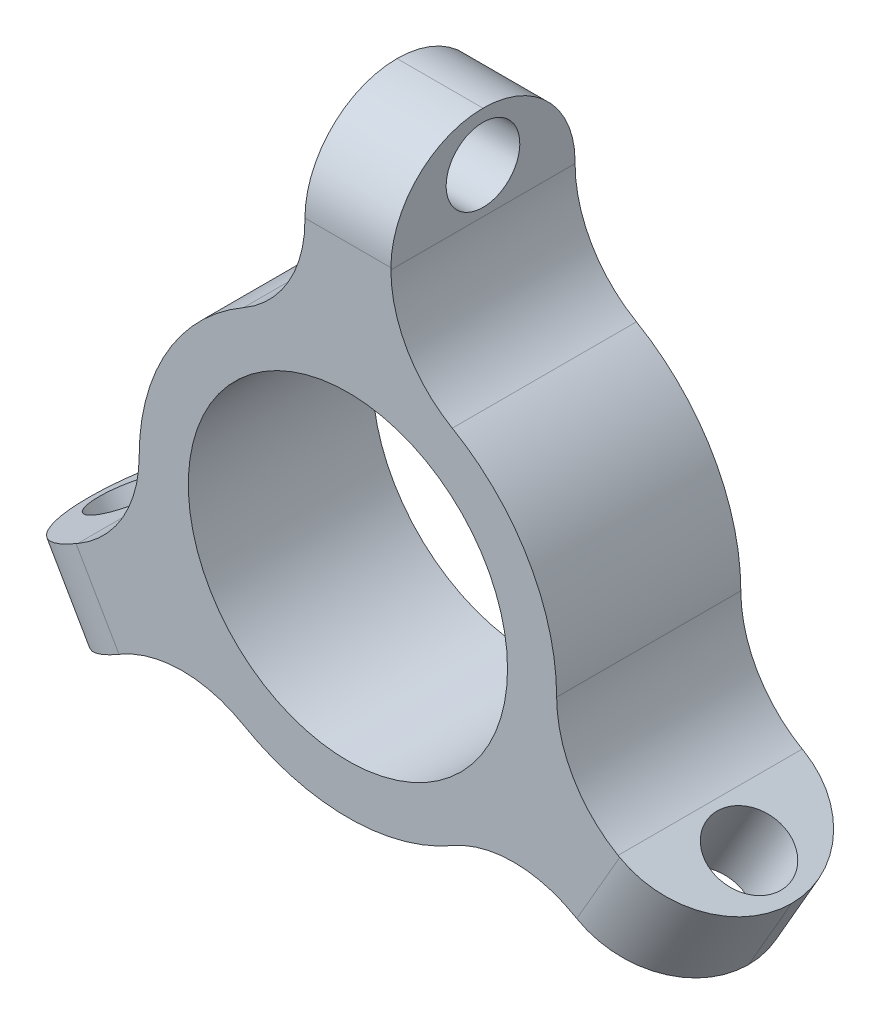
from build123d import *

# Parameters (mm, degrees)
ESQUISSE1_R                  = 13
BOSS_EXTRU_1_DEPTH           = 15
CONG_1_R                     = 7.5
CONG_2_R                     = 7.5
CONG_3_R                     = 7.5
ENL_V_MAT_EXTRU_1_REACH      = 50.052
ESQUISSE2_R                  = 3
R_P_TITION_CIRCULAIRE1_COUNT = 3


with BuildPart() as part:
    # Esquisse1 → Boss.-Extru.1 (new body)
    with BuildSketch(Plane.XY):
        with BuildLine():
            Line((-3.5, 23.382685902), (-3.5, 31.041209697))
            Line((-3.5, 31.041209697), (3.5, 31.041209697))
            Line((3.5, 31.041209697), (3.5, 23.382685902))
            ThreePointArc((3.5, 23.382685902), (4.839745962, 18.382685902), (8.5, 14.722431864))
            ThreePointArc((8.5, 14.722431864), (14.722431864, 8.5), (17, 0))
            ThreePointArc((17, 0), (18.339745962, -5), (22, -8.660254038))
            Line((22, -8.660254038), (28.632476161, -12.489515935))
            Line((28.632476161, -12.489515935), (25.132476161, -18.551693762))
            Line((25.132476161, -18.551693762), (18.5, -14.722431864))
            ThreePointArc((18.5, -14.722431864), (13.5, -13.382685902), (8.5, -14.722431864))
            ThreePointArc((8.5, -14.722431864), (0, -17), (-8.5, -14.722431864))
            ThreePointArc((-8.5, -14.722431864), (-13.5, -13.382685902), (-18.5, -14.722431864))
            Line((-18.5, -14.722431864), (-25.132476161, -18.551693762))
            Line((-25.132476161, -18.551693762), (-28.632476161, -12.489515935))
            Line((-28.632476161, -12.489515935), (-22, -8.660254038))
            ThreePointArc((-22, -8.660254038), (-18.339745962, -5), (-17, 0))
            ThreePointArc((-17, 0), (-14.722431864, 8.5), (-8.5, 14.722431864))
            ThreePointArc((-8.5, 14.722431864), (-4.839745962, 18.382685902), (-3.5, 23.382685902))
        make_face()
        Circle(ESQUISSE1_R, mode=Mode.SUBTRACT)
    extrude(amount=BOSS_EXTRU_1_DEPTH)

    # Congé1
    cong_1_edges = [part.edges().sort_by_distance(p)[0] for p in [
        (0, 31.041209697, 0),
        (0, 31.041209697, 15),
    ]]
    fillet(cong_1_edges, radius=CONG_1_R - 0.0001)  # a hair under: the kernel refuses the full size

    # Congé2
    cong_2_edges = [part.edges().sort_by_distance(p)[0] for p in [
        (26.882476161, -15.520604848, 0),
        (26.882476161, -15.520604848, 15),
    ]]
    fillet(cong_2_edges, radius=CONG_2_R - 0.0001)  # a hair under: the kernel refuses the full size

    # Congé3
    cong_3_edges = [part.edges().sort_by_distance(p)[0] for p in [
        (-26.882476161, -15.520604848, 15),
        (-26.882476161, -15.520604848, 0),
    ]]
    fillet(cong_3_edges, radius=CONG_3_R - 0.0001)  # a hair under: the kernel refuses the full size

    # Esquisse2 → Enlèv. mat.-Extru.1 (cut, up to next)
    with BuildSketch(Plane(origin=(-1.75, -3.031088913, 0), x_dir=(0.8660254037844389, -0.4999999999999995, 0), z_dir=(-0.4999999999999995, -0.8660254037844389, 0)), mode=Mode.PRIVATE) as enl_v_mat_extru_1_sk1:
        with Locations((27.041209697, 7.5)):
            Circle(ESQUISSE2_R)
    enl_v_mat_extru_1_tool1 = extrude(enl_v_mat_extru_1_sk1.sketch, amount=-ENL_V_MAT_EXTRU_1_REACH, mode=Mode.PRIVATE) & part.part
    enl_v_mat_extru_1 = enl_v_mat_extru_1_tool1.solids().sort_by_distance((21.668375, -16.551694, 7.5))[0]
    add(enl_v_mat_extru_1, mode=Mode.SUBTRACT)

    # Répétition circulaire1: Enlèv. mat.-Extru.1 ×3 about axis
    r_p_tition_circulaire1_axis = Axis((0, 0, 15), (0, 0, -1))
    for i in range(1, R_P_TITION_CIRCULAIRE1_COUNT):
        add(enl_v_mat_extru_1.rotate(r_p_tition_circulaire1_axis, i * 360 / R_P_TITION_CIRCULAIRE1_COUNT), mode=Mode.SUBTRACT)


solid = part.part
